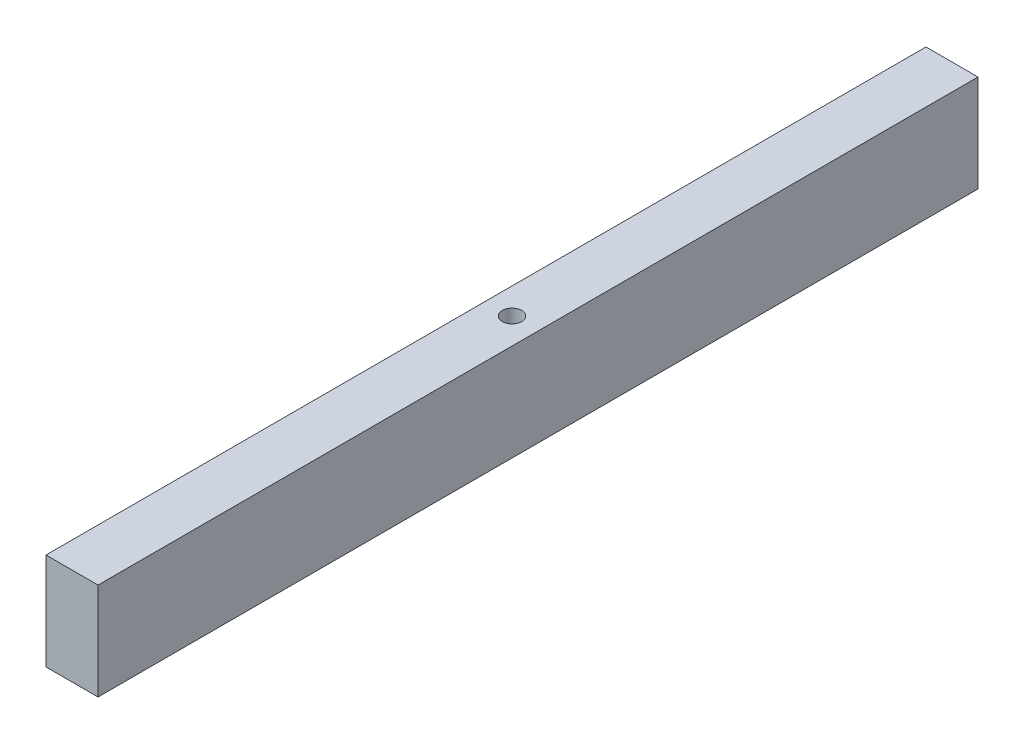
from build123d import *

# Parameters (mm, degrees)
SKETCH1_W           = 22
SKETCH1_H           = 41
BOSS_EXTRUDE1_DEPTH = 186
SKETCH2_R           = 4.1
CUT_EXTRUDE1_DEPTH  = 46


with BuildPart() as part:
    # Sketch1 → Boss-Extrude1 (new, symmetric)
    with BuildSketch(Plane.XY):
        with Locations((0, 20.5)):
            Rectangle(SKETCH1_W, SKETCH1_H)
    extrude(amount=BOSS_EXTRUDE1_DEPTH, both=True)

    # Sketch2 → Cut-Extrude1 (cut, symmetric)
    with BuildSketch(Plane(origin=(0, 0, 0), x_dir=(1, 0, 0), z_dir=(0, 1, 0))):
        Circle(SKETCH2_R)
    extrude(amount=CUT_EXTRUDE1_DEPTH, both=True, mode=Mode.SUBTRACT)


solid = part.part
